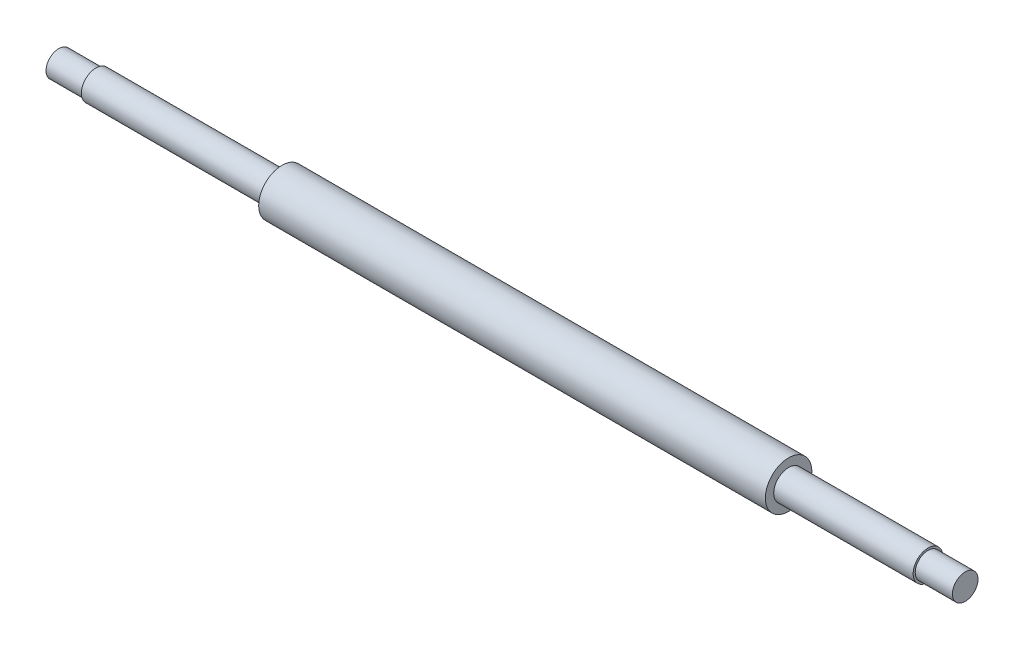
from build123d import *


with BuildPart() as part:
    # Sketch1 → Revolve1 (revolve)
    with BuildSketch(Plane(origin=(0, 0, 0), x_dir=(1, 0, 0), z_dir=(0, 1, 0))):
        Polygon((-77.419354839, 0), (-77.419354839, 3.499993), (-67.259354839, 3.499993), (-67.259354839, 4), (-16.459354839, 4), (-16.459354839, 6.349993), (121.970645161, 6.349993), (121.970645161, 4.064), (160.070645161, 4.064), (160.070645161, 3.499993), (170.230645161, 3.499993), (170.230645161, 0), align=None)
    revolve(axis=Axis((-97.950567047, 0, 0), (1, 0, 0)))


solid = part.part
